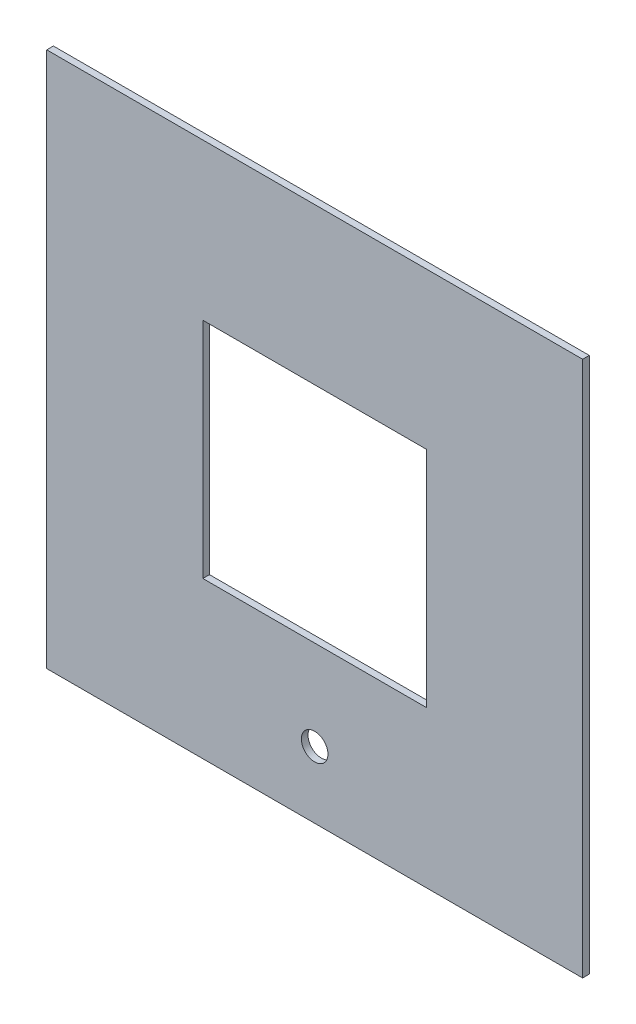
from build123d import *

# Parameters (mm, degrees)
SKETCH1_W           = 242
SKETCH1_H           = 242
SKETCH1_W_2         = 101
SKETCH1_H_2         = 101
BOSS_EXTRUDE1_DEPTH = 3
CUT_EXTRUDE1_REACH  = 173.146
SKETCH2_R           = 6


with BuildPart() as part:
    # Sketch1 → Boss-Extrude1 (new body)
    with BuildSketch(Plane.XY):
        Rectangle(SKETCH1_W, SKETCH1_H)
        Rectangle(SKETCH1_W_2, SKETCH1_H_2, mode=Mode.SUBTRACT)
    extrude(amount=BOSS_EXTRUDE1_DEPTH)

    # Sketch2 → Cut-Extrude1 (cut, up to next)
    with BuildSketch(Plane.XY.offset(3), mode=Mode.PRIVATE) as cut_extrude1_sk1:
        with Locations((0, -91)):
            Circle(SKETCH2_R)
    cut_extrude1_tool1 = extrude(cut_extrude1_sk1.sketch, amount=-CUT_EXTRUDE1_REACH, mode=Mode.PRIVATE) & part.part
    add(cut_extrude1_tool1.solids().sort_by_distance((0, -91, 3))[0], mode=Mode.SUBTRACT)


solid = part.part
